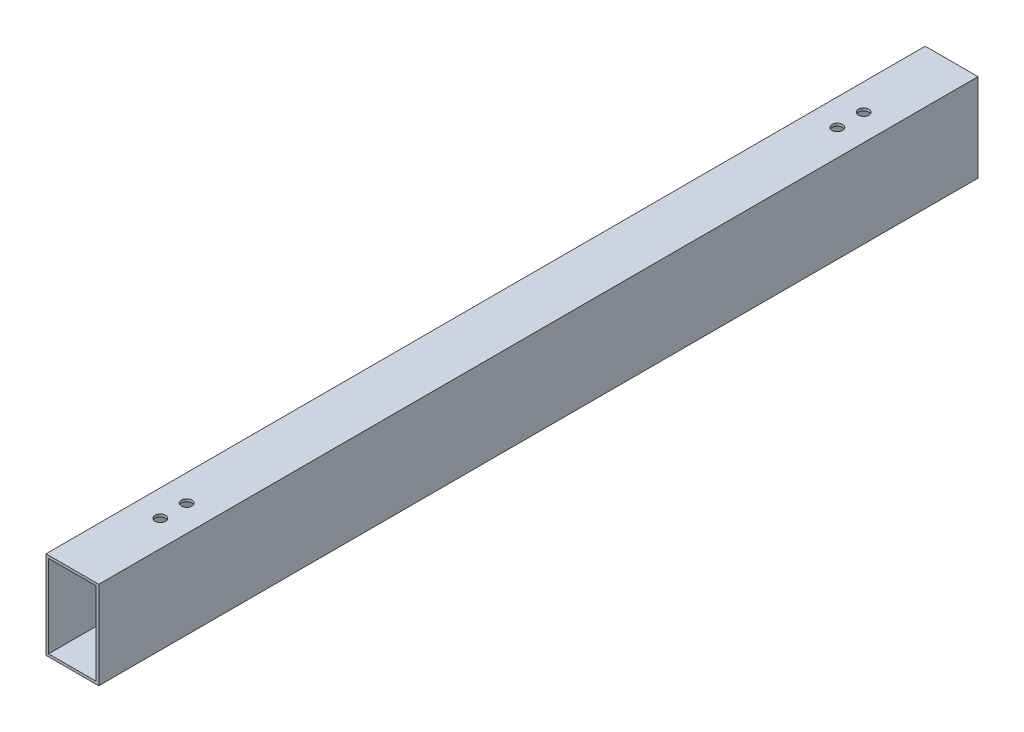
from build123d import *

# Parameters (mm, degrees)
SZKIC1_W                    = 30
SZKIC1_H                    = 50
DODANIE_WYCI_GNI_CIE1_DEPTH = 500
SZKIC2_W                    = 27
SZKIC2_H                    = 47
WYTNIJ_WYCI_GNI_CIE7_DEPTH  = 504.388517946
SZKIC5_R                    = 3
WYTNIJ_WYCI_GNI_CIE13_DEPTH = 504.388517946


with BuildPart() as part:
    # Szkic1 → Dodanie-wyciągnięcie1 (new body)
    with BuildSketch(Plane.XY):
        with Locations((15, 25)):
            Rectangle(SZKIC1_W, SZKIC1_H)
    extrude(amount=DODANIE_WYCI_GNI_CIE1_DEPTH)

    # Szkic2 → Wytnij-wyciągnięcie7 (cut, through all)
    with BuildSketch(Plane.XY):
        with Locations((15, 25)):
            Rectangle(SZKIC2_W, SZKIC2_H)
    extrude(amount=WYTNIJ_WYCI_GNI_CIE7_DEPTH, mode=Mode.SUBTRACT)

    # Szkic5 → Wytnij-wyciągnięcie13 (cut, through all)
    with BuildSketch(Plane(origin=(0, 0, 0), x_dir=(1, 0, 0), z_dir=(0, 1, 0))):
        with Locations((15, -450)):
            Circle(SZKIC5_R)
        with Locations((15, -435)):
            Circle(SZKIC5_R)
        with Locations((15, -50)):
            Circle(SZKIC5_R)
        with Locations((15, -65)):
            Circle(SZKIC5_R)
    extrude(amount=WYTNIJ_WYCI_GNI_CIE13_DEPTH, mode=Mode.SUBTRACT)


solid = part.part
